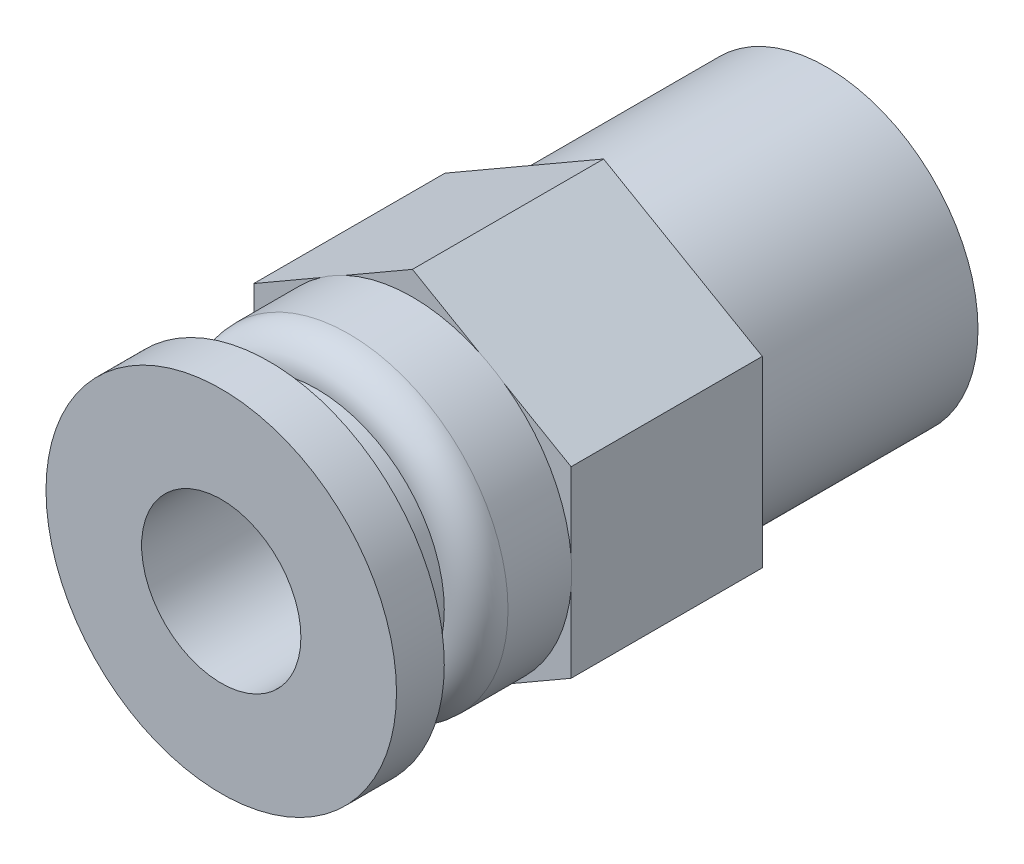
from build123d import *

# Parameters (mm, degrees)
SKETCH1_R           = 4.75
BOSS_EXTRUDE1_DEPTH = 7
SKETCH2_R           = 2.5
BOSS_EXTRUDE2_DEPTH = 6
SKETCH3_R           = 5
SKETCH3_R_2         = 2.5
BOSS_EXTRUDE3_DEPTH = 3
SKETCH4_R           = 4
SKETCH4_R_2         = 2.5
BOSS_EXTRUDE4_DEPTH = 1.5
FILLET2_R           = 1
FILLET3_R           = 1
SKETCH5_R           = 5.5
SKETCH5_R_2         = 2.5
BOSS_EXTRUDE5_DEPTH = 1.5


with BuildPart() as part:
    # Sketch1 → Boss-Extrude1 (new body)
    with BuildSketch(Plane.XY):
        Circle(SKETCH1_R)
        Polygon((0, 1.5), (-1.299038106, 0.75), (-1.299038106, -0.75), (0, -1.5), (1.299038106, -0.75), (1.299038106, 0.75), align=None, mode=Mode.SUBTRACT)
    extrude(amount=BOSS_EXTRUDE1_DEPTH)

    # Sketch2 → Boss-Extrude2 (add)
    with BuildSketch(Plane.XY.offset(7)):
        Polygon((0, 5.75), (-4.979646072, 2.875), (-4.979646072, -2.875), (0, -5.75), (4.979646072, -2.875), (4.979646072, 2.875), align=None)
        Circle(SKETCH2_R, mode=Mode.SUBTRACT)
    extrude(amount=BOSS_EXTRUDE2_DEPTH)

    # Sketch3 → Boss-Extrude3 (add)
    with BuildSketch(Plane.XY.offset(13)):
        with Locations(Location((0, 0, 0), (0, 0, 174.828408841))):
            Circle(SKETCH3_R)
        Circle(SKETCH3_R_2, mode=Mode.SUBTRACT)
    extrude(amount=BOSS_EXTRUDE3_DEPTH)

    # Sketch4 → Boss-Extrude4 (add)
    with BuildSketch(Plane.XY.offset(16)):
        Circle(SKETCH4_R)
        Circle(SKETCH4_R_2, mode=Mode.SUBTRACT)
    extrude(amount=BOSS_EXTRUDE4_DEPTH)

    # Fillet2
    fillet2_edges = [part.edges().sort_by_distance(p)[0] for p in [
        (4.979646072, -0.450693909, 16),
    ]]
    fillet(fillet2_edges, radius=FILLET2_R - 0.0001)  # a hair under: the kernel refuses the full size

    # Fillet3
    fillet3_edges = [part.edges().sort_by_distance(p)[0] for p in [
        (-2.5, 0, 7),
    ]]
    fillet(fillet3_edges, radius=FILLET3_R - 0.0001)  # a hair under: the kernel refuses the full size

    # Sketch5 → Boss-Extrude5 (add)
    with BuildSketch(Plane.XY.offset(17.5)):
        Circle(SKETCH5_R)
        Circle(SKETCH5_R_2, mode=Mode.SUBTRACT)
    extrude(amount=BOSS_EXTRUDE5_DEPTH)


solid = part.part
